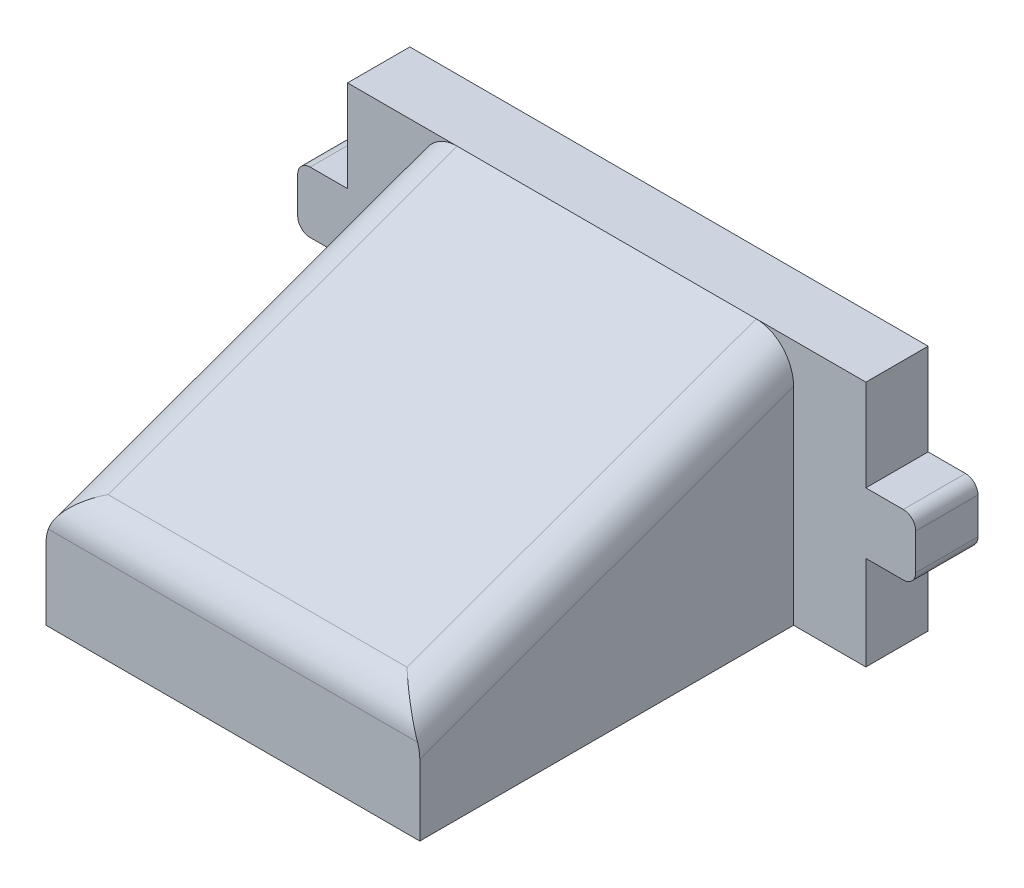
from build123d import *

# Parameters (mm, degrees)
SKETCH_1_W             = 41.6
SKETCH_1_H             = 19.8
EXTRUDE_1_DEPTH        = 5
SKETCH_2_W             = 5
SKETCH_2_H             = 4.9
EXTRUDE_2_DEPTH        = 4
FILLET_1_R             = 1
FILLET_1_OF_MIRROR_1_R = 1
SKETCH_3_W             = 30
SKETCH_3_H             = 19.8
EXTRUDE_3_DEPTH        = 30
DRAFT_START            = 11.013057662
DRAFT_1_OUTLINE_W      = 30
DRAFT_1_OUTLINE_H      = 35
DRAFT_1_DEPTH          = 10.2606043
FILLET_2_R             = 3


# Read off the part's stored shape, not the designer's step: 구배1
with BuildPart() as part:
    # 스케치1 → 보스-돌출1 (new body)
    with BuildSketch(Plane.XY):
        Rectangle(SKETCH_1_W, SKETCH_1_H)
    extrude(amount=EXTRUDE_1_DEPTH)

    # 스케치2 → 보스-돌출2 (add)
    with BuildSketch(Plane(origin=(20.8, 0, 0), x_dir=(0, 0, -1), z_dir=(1, 0, 0))):
        with Locations((-2.5, 0.1)):
            Rectangle(SKETCH_2_W, SKETCH_2_H)
    extrude_2 = extrude(amount=EXTRUDE_2_DEPTH)

    # 필렛1
    fillet_1_edges = [part.edges().sort_by_distance(p)[0] for p in [
        (24.8, 2.55, 2.5),
        (24.8, -2.35, 2.5),
    ]]
    fillet(fillet_1_edges, radius=FILLET_1_R)

    # 대칭 복사1: 보스-돌출2 across plane
    add(extrude_2.mirror(Plane(origin=(0, 0, 0), x_dir=(0, 0, 1), z_dir=(1, 0, 0))))

    # 필렛1 of 대칭 복사1
    fillet_1_of_mirror_1_edges = [part.edges().sort_by_distance(p)[0] for p in [
        (-24.8, 2.55, 2.5),
        (-24.8, -2.35, 2.5),
    ]]
    fillet(fillet_1_of_mirror_1_edges, radius=FILLET_1_OF_MIRROR_1_R)

    # 스케치3 → 보스-돌출3 (add)
    with BuildSketch(Plane.XY.offset(5)):
        Rectangle(SKETCH_3_W, SKETCH_3_H)
    extrude(amount=EXTRUDE_3_DEPTH)

    # 구배1 outline → 구배1 (cut)
    with BuildSketch(Plane(origin=(0, 0, 0), x_dir=(1, 0, 0), z_dir=(0, 0.9396926207859083, 0.3420201433256691)).offset(DRAFT_START)):
        with Locations((0, -17.5)):
            Rectangle(DRAFT_1_OUTLINE_W, DRAFT_1_OUTLINE_H)
    extrude(amount=DRAFT_1_DEPTH, mode=Mode.SUBTRACT)

    # 필렛2
    fillet_2_edges = [part.edges().sort_by_distance(p)[0] for p in [
        (15, 4.440446486, 20),
        (-15, 4.440446486, 20),
        (0, -1.019107028, 35),
    ]]
    fillet(fillet_2_edges, radius=FILLET_2_R)


solid = part.part
